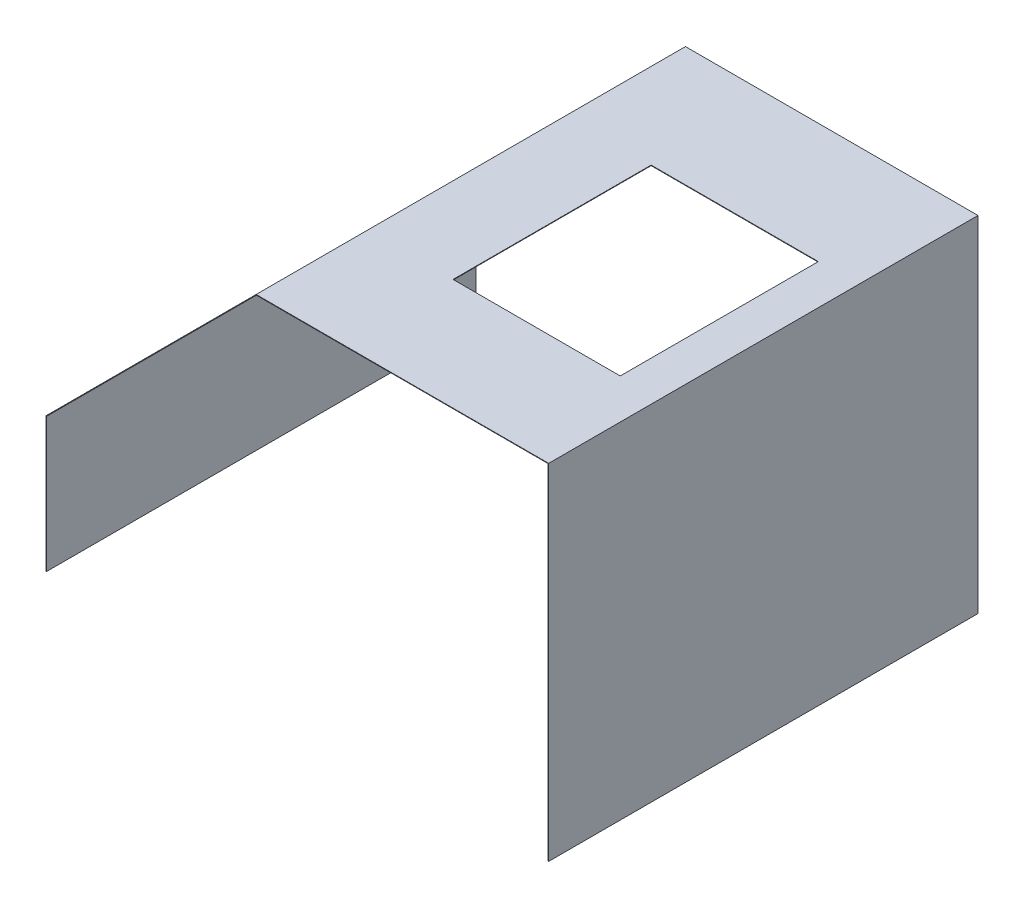
from build123d import *

# Parameters (mm, degrees)
SALIENTE_EXTRUIR1_DEPTH    = 0.83566
SALIENTE_EXTRUIR2_DEPTH    = 12.7
SALIENTE_EXTRUIR3_DEPTH    = 642.126
CROQUIS4_W                 = 255
CROQUIS4_H                 = 0.83566
SALIENTE_EXTRUIR4_DEPTH    = 170
CROQUIS5_W                 = 255
CROQUIS5_H                 = 0.83566
SALIENTE_EXTRUIR5_DEPTH    = 170
CROQUIS6_W                 = 570
CROQUIS6_H                 = 401.24062337
CORTAR_EXTRUIR1_DEPTH      = 190
CORTAR_EXTRUIR2_DEPTH      = 198
CORTAR_EXTRUIR2_DEPTH_BACK = 174


with BuildPart() as part:
    # Croquis1 → Saliente-Extruir1 (new body)
    with BuildSketch(Plane.XY):
        Polygon((0, 0), (765, 0), (765, 525), (320, 525), (0, 205), align=None)
    extrude(amount=SALIENTE_EXTRUIR1_DEPTH)

    # Croquis7 → Cortar-Extruir2 (cut, two sides: drawn at the far end of the back side and taken through both)
    with BuildSketch(Plane.XY.offset(0.83566).offset(-CORTAR_EXTRUIR2_DEPTH_BACK)):
        Polygon((0, 0), (765, 0), (765, 525), (320, 525), (0, 205), align=None)
    extrude(amount=CORTAR_EXTRUIR2_DEPTH + CORTAR_EXTRUIR2_DEPTH_BACK, mode=Mode.SUBTRACT)


with BuildPart() as body_2:
    # Croquis2 → Saliente-Extruir2 (new body)
    with BuildSketch(Plane.XY.offset(0.83566)):
        Polygon((765.83566, 525.83566), (319.653858294, 525.83566), (-0.83566, 205.346141706), (-0.83566, 0), (0, 0), (0, 205), (320, 525), (765, 525), (765, 0), (765.83566, 0), align=None)
    extrude(amount=SALIENTE_EXTRUIR2_DEPTH)

    # Croquis3 → Saliente-Extruir3 (add)
    with BuildSketch(Plane.XY.offset(13.53566)):
        Polygon((450, 525.83566), (450, 525), (320, 525), (0, 205), (0, 0), (-0.83566, 0), (-0.83566, 205.346141706), (319.653858294, 525.83566), align=None)
        Polygon((765.83566, 0), (765.83566, 525.83566), (705, 525.83566), (705, 525), (765, 525), (765, 0), align=None)
    extrude(amount=SALIENTE_EXTRUIR3_DEPTH)

    # Croquis4 → Saliente-Extruir4 (add)
    with BuildSketch(Plane.XY.offset(13.53566)):
        with Locations((577.5, 525.41783)):
            Rectangle(CROQUIS4_W, CROQUIS4_H)
    extrude(amount=SALIENTE_EXTRUIR4_DEPTH)

    # Croquis5 → Saliente-Extruir5 (add)
    with BuildSketch(Plane.XY.offset(655.66166)):
        with Locations((577.5, 525.41783)):
            Rectangle(CROQUIS5_W, CROQUIS5_H)
    extrude(amount=-SALIENTE_EXTRUIR5_DEPTH)

    # Croquis6 → Cortar-Extruir1 (cut)
    with BuildSketch(Plane(origin=(-103.090900853, 103.090900853, 0), x_dir=(0, 0, 1), z_dir=(-0.7071067811865477, 0.7071067811865475, 0))):
        with Locations((328.24866, 397.231060123)):
            Rectangle(CROQUIS6_W, CROQUIS6_H)
    extrude(amount=-CORTAR_EXTRUIR1_DEPTH, mode=Mode.SUBTRACT)


solid = body_2.part
